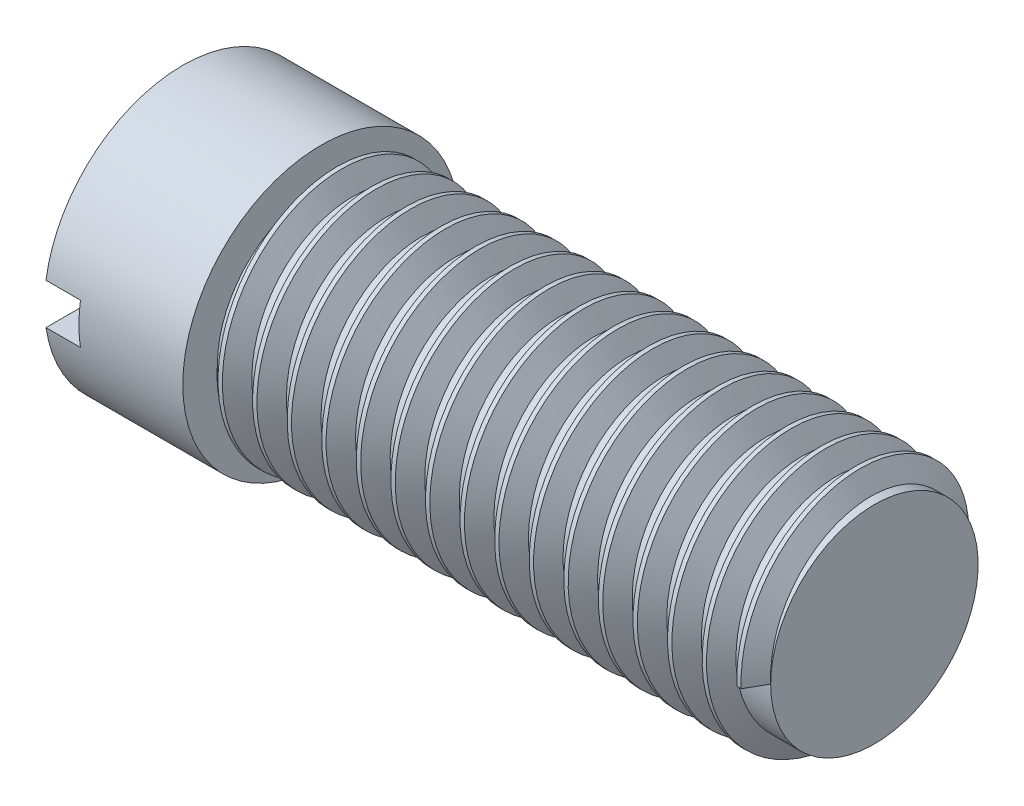
from build123d import *

# Parameters (mm, degrees)
CUT_EXTRUDE1_DEPTH      = 6.744562647
CUT_EXTRUDE1_DEPTH_BACK = 6.744562647
SKETCH2_W               = 0.997255986
SKETCH2_H               = 0.591729654
THREAD2_PITCH           = 0.5


with BuildPart() as part:
    # Sketch1 → Revolve1 (revolve)
    with BuildSketch(Plane.XY, mode=Mode.PRIVATE) as revolve1_sk:
        Polygon((-5, 0), (5, 0), (5, 1.5), (-3, 1.5), (-3, 2), (-5, 2), align=None)
    revolve(revolve1_sk.sketch.rotate(Axis((-5, 0, 0), (1, 0, 0)), 90), axis=Axis((-5, 0, 0), (1, 0, 0)))

    # Sketch2 → Cut-Extrude1 (cut, two sides: drawn at the far end of the back side and taken through both)
    with BuildSketch(Plane.XY.offset(-CUT_EXTRUDE1_DEPTH_BACK)):
        with Locations((-5, 0)):
            Rectangle(SKETCH2_W, SKETCH2_H)
    extrude(amount=CUT_EXTRUDE1_DEPTH + CUT_EXTRUDE1_DEPTH_BACK, mode=Mode.SUBTRACT)

    # Thread2: the profile of Thread Profile2 profile screwed along a right-hand helix of 16 turns, 6 arcs to a turn; built about Z, then put on its axis
    thread2_z = Axis((0, 0, 0), (0, 0, 1))
    thread2_corners = [(1.4997, 0, -0.000173205), (1.770632938, 0, 0.156249999), (1.770632937, 0, 0.218749999), (1.4997, 0, 0.375173204)]
    with BuildLine(mode=Mode.PRIVATE) as thread2_profile:
        Line(thread2_corners[0], thread2_corners[1])
        Line(thread2_corners[1], thread2_corners[2])
        Line(thread2_corners[2], thread2_corners[3])
        Line(thread2_corners[3], thread2_corners[0])
    thread2_cap = Face(thread2_profile.wire())
    thread2_turn_angles = [0, 30, 60, 90, 120, 150, 180, 210, 240, 270, 300, 330, 360]
    thread2_turn_weights = [1, 0.8660254037844387, 1, 0.8660254037844387, 1, 0.8660254037844387, 1, 0.8660254037844387, 1, 0.8660254037844387, 1, 0.8660254037844387, 1]
    thread2_turn_rails = [Edge.make_bspline([Vector(p[0], p[1], 0).rotate(thread2_z, thread2_turn_angles[k]) / thread2_turn_weights[k] + Vector(0, 0, p[2] + THREAD2_PITCH * thread2_turn_angles[k] / 360) for k in range(13)], [0, 0, 0, 1, 1, 2, 2, 3, 3, 4, 4, 5, 5, 6, 6, 6], 2, thread2_turn_weights) for p in thread2_corners]
    thread2_turn_sides = [Face.make_surface_from_curves(thread2_turn_rails[p[0]], thread2_turn_rails[p[1]]) for p in [(0, 1), (1, 2), (2, 3), (3, 0)]]
    thread2 = Plane(origin=(5, 0, 0), x_dir=(0, 0, 1), z_dir=(-1, 0, 0)) * Solid(Shell([*[p.moved(Location((0, 0, THREAD2_PITCH * i))) for i in range(16) for p in thread2_turn_sides], thread2_cap, thread2_cap.rotate(thread2_z, 5760).moved(Location((0, 0, THREAD2_PITCH * 5760 / 360)))]))
    add(thread2)


solid = part.part
